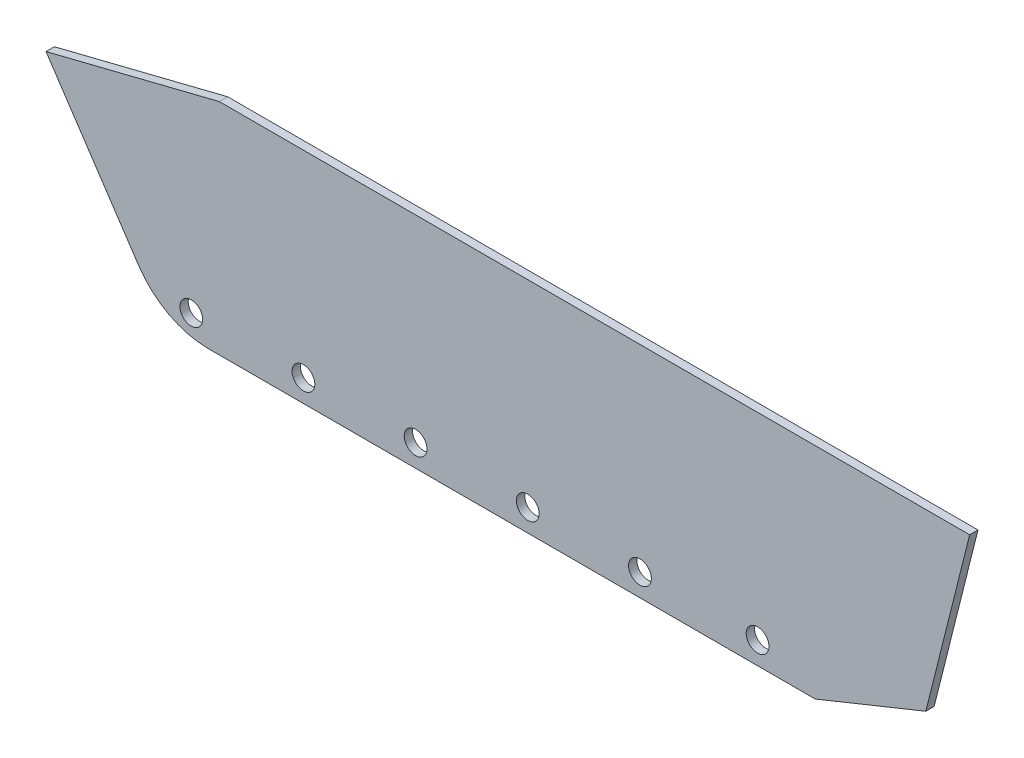
from build123d import *

# Parameters (mm, degrees)
BOSS_EXTRUDE1_DEPTH = 4.7625
SKETCH1_4_R         = 6.5
CUT_EXTRUDE1_DEPTH  = 439.920211962
FILLET1_R           = 48
CUT_EXTRUDE3_DEPTH  = 10


with BuildPart() as part:
    # Sketch1 → Boss-Extrude1 (new body)
    with BuildSketch(Plane.XY):
        Polygon((428.120588235, 28.570833333), (0, 28.570833333), (-98.879411765, 3.850980392), (-31.879411765, -96.649019608), (366, -96.649019608), (403.120588235, -71.149019608), align=None)
    extrude(amount=BOSS_EXTRUDE1_DEPTH)

    # Sketch1<4> → Cut-Extrude1 (cut, through all)
    with BuildSketch(Plane.XY):
        with Locations((-16, -83.899019608)):
            Circle(SKETCH1_4_R)
        with Locations((48, -83.899019608)):
            Circle(SKETCH1_4_R)
        with Locations((112, -83.899019608)):
            Circle(SKETCH1_4_R)
        with Locations((176, -83.899019608)):
            Circle(SKETCH1_4_R)
        with Locations((240, -83.899019608)):
            Circle(SKETCH1_4_R)
        with Locations((307.120588235, -83.899019608)):
            Circle(SKETCH1_4_R)
    extrude(amount=CUT_EXTRUDE1_DEPTH, mode=Mode.SUBTRACT)

    # Fillet1
    fillet1_edges = [part.edges().sort_by_distance(p)[0] for p in [
        (-31.879411765, -96.649019608, 2.38125),
    ]]
    fillet(fillet1_edges, radius=FILLET1_R)

    # Sketch7 → Cut-Extrude3 (cut)
    with BuildSketch(Plane.XY.offset(4.7625)):
        Polygon((403.120588235, -71.149019608), (340.005873473, -96.649019608), (366, -96.649019608), align=None)
    extrude(amount=-CUT_EXTRUDE3_DEPTH, mode=Mode.SUBTRACT)


solid = part.part
